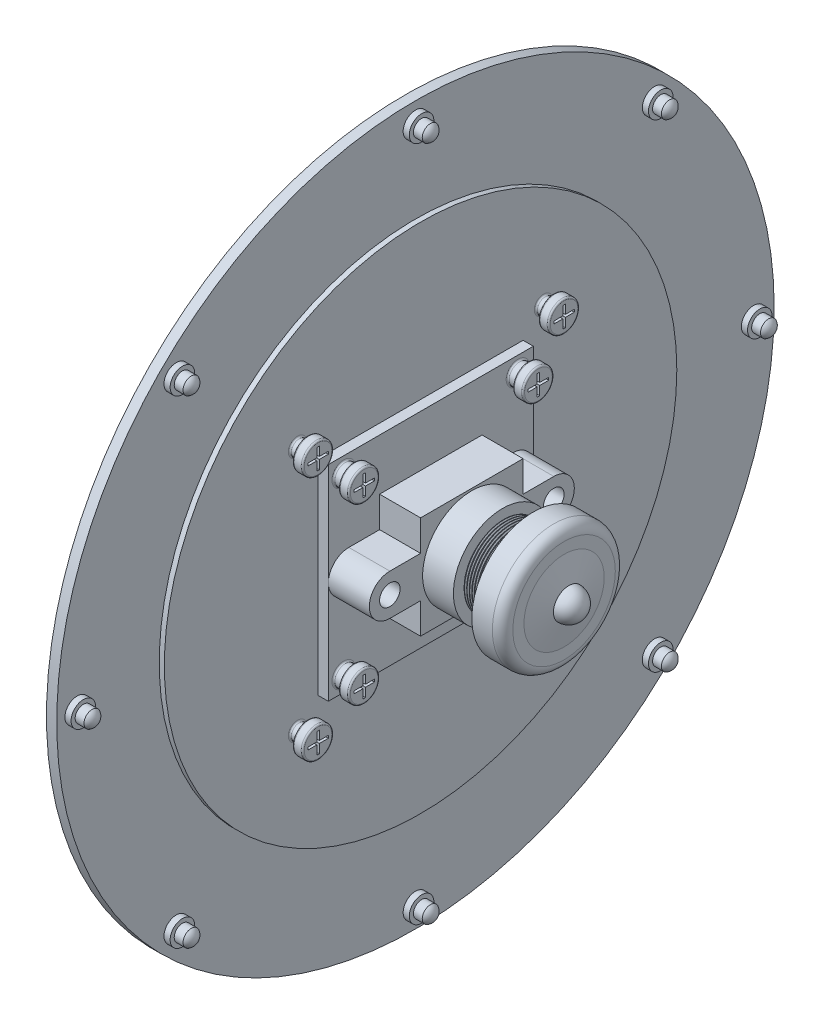
from build123d import *
from build123d.topology import SkipClean

# Parameters (mm, degrees)
SKETCH_1_R               = 35
EXTRUDE_1_DEPTH          = 1
SKETCH_2_W               = 30
SKETCH_2_H               = 30
EXTRUDE_2_DEPTH          = 0.5
EXTRUDE_3_DEPTH          = 5
SKETCH_4_R               = 1
CUT_EXTRUDE_1_DEPTH      = 20
SKETCH_5_R               = 4.8
EXTRUDE_4_DEPTH          = 3
SKETCH_6_R               = 3.75
EXTRUDE_5_DEPTH          = 2
THREAD_1_PITCH           = 0.25
SKETCH_10_R              = 4.088394557
EXTRUDE_6_DEPTH          = 1
SKETCH_11_R              = 6
EXTRUDE_7_DEPTH          = 3
FILLET_1_R               = 1
SKETCH_15_R              = 1.5
EXTRUDE_8_DEPTH          = 2
PATTERN_CIRCULAR_1_COUNT = 8
EXTRUDE_START            = -1
EXTRUDE_9_OUTLINE_R      = 25
EXTRUDE_9_OUTLINE_W      = 30
EXTRUDE_9_OUTLINE_H      = 30
EXTRUDE_9_DEPTH          = 1
SKETCH_18_W              = 20
SKETCH_18_H              = 20
EXTRUDE_10_DEPTH         = 1
EXTRUDE_11_DEPTH         = 2.5
EXTRUDE_12_DEPTH         = 0.5
SKETCH_22_R              = 1
EXTRUDE_13_DEPTH         = 2
SKETCH_23_R              = 1.5
EXTRUDE_14_DEPTH         = 1
SKETCH_24_W              = 2
SKETCH_24_H              = 0.25
CUT_EXTRUDE_2_DEPTH      = 0.5
SKETCH_25_W              = 0.25
SKETCH_25_H              = 2
CUT_EXTRUDE_3_DEPTH      = 0.5
FILLET_2_R               = 0.15
FILLET_3_R               = 0.15
FILLET_4_R               = 0.15
FILLET_5_R               = 0.15
FILLET_6_R               = 0.15
FILLET_7_R               = 0.15
FILLET_8_R               = 0.15
FILLET_9_R               = 0.15
SKETCH_26_W              = 1
SKETCH_26_H              = 0.75
PATTERN_CIRCULAR_2_COUNT = 4
SKETCH_27_W              = 2
SKETCH_27_H              = 0.25
CUT_EXTRUDE_4_DEPTH      = 0.5
SKETCH_28_W              = 0.25
SKETCH_28_H              = 2
CUT_EXTRUDE_5_DEPTH      = 0.5
FILLET_10_R              = 0.15
FILLET_11_R              = 0.15
PATTERN_CIRCULAR_5_COUNT = 4
FILLET_12_R              = 0.15
FILLET_13_R              = 0.15
FILLET_14_R              = 0.15
FILLET_15_R              = 0.15
FILLET_16_R              = 0.15
FILLET_17_R              = 0.15


with BuildPart() as part:
    # Sketch 1 → 凸台-拉伸1 (new body)
    with BuildSketch(Plane(origin=(0, 0, 0), x_dir=(0, 0, -1), z_dir=(1, 0, 0))):
        Circle(SKETCH_1_R)
    extrude(amount=EXTRUDE_1_DEPTH)

    # 草图2 → 凸台-拉伸2 (add)
    with BuildSketch(Plane(origin=(1, 0, 0), x_dir=(0, 0, -1), z_dir=(1, 0, 0))):
        Rectangle(SKETCH_2_W, SKETCH_2_H)
    extrude(amount=EXTRUDE_2_DEPTH)

    # 草图3 → 凸台-拉伸3 (add)
    with BuildSketch(Plane(origin=(1.5, 0, 0), x_dir=(0, 0, -1), z_dir=(1, 0, 0))):
        with BuildLine():
            Line((-5, 5), (5, 5))
            Line((5, 5), (5, 2))
            Line((5, 2), (8, 2))
            ThreePointArc((8, 2), (10, 0), (8, -2))
            Line((8, -2), (5, -2))
            Line((5, -2), (5, -5))
            Line((5, -5), (-5, -5))
            Line((-5, -5), (-5, -2))
            Line((-5, -2), (-8, -2))
            ThreePointArc((-8, -2), (-10, 0), (-8, 2))
            Line((-8, 2), (-5, 2))
            Line((-5, 2), (-5, 5))
        make_face()
    extrude(amount=EXTRUDE_3_DEPTH)

    # 草图4 → 切除-拉伸1 (cut)
    with BuildSketch(Plane(origin=(6.5, 0, 0), x_dir=(0, 0, -1), z_dir=(1, 0, 0))):
        with Locations((-8, 0)):
            Circle(SKETCH_4_R)
        with Locations((8, 0)):
            Circle(SKETCH_4_R)
    extrude(amount=-CUT_EXTRUDE_1_DEPTH, mode=Mode.SUBTRACT)

    # 草图5 → 凸台-拉伸4 (add)
    with BuildSketch(Plane(origin=(6.5, 0, 0), x_dir=(0, 0, -1), z_dir=(1, 0, 0))):
        Circle(SKETCH_5_R)
    extrude(amount=EXTRUDE_4_DEPTH)

    # 草图6 → 凸台-拉伸5 (add)
    with BuildSketch(Plane(origin=(9.5, 0, 0), x_dir=(0, 0, -1), z_dir=(1, 0, 0))):
        Circle(SKETCH_6_R)
    extrude(amount=EXTRUDE_5_DEPTH)

    # 螺纹线1: arcs per turn and ends read off the stored shape
    # 螺纹线1: the profile of Sketch 1 2 profile screwed along a right-hand helix through 8 turns, 6 arcs to a turn; built about Z, then put on its axis
    with SkipClean():  # the faces are left unmerged after this step: merging them gives an invalid solid
        thread_1_z = Axis((0, 0, 0), (0, 0, 1))
        thread_1_corners = [(3.7497, 0, -0.000173205), (3.885316469, 0, 0.078125), (3.885316469, 0, 0.109375), (3.7497, 0, 0.187673204)]
        with BuildLine(mode=Mode.PRIVATE) as thread_1_profile:
            Line(thread_1_corners[0], thread_1_corners[1])
            Line(thread_1_corners[1], thread_1_corners[2])
            Line(thread_1_corners[2], thread_1_corners[3])
            Line(thread_1_corners[3], thread_1_corners[0])
        thread_1_cap = Face(thread_1_profile.wire())
        thread_1_turn_angles = [0, 30, 60, 90, 120, 150, 180, 210, 240, 270, 300, 330, 360]
        thread_1_turn_weights = [1, 0.8660254037844387, 1, 0.8660254037844387, 1, 0.8660254037844387, 1, 0.8660254037844387, 1, 0.8660254037844387, 1, 0.8660254037844387, 1]
        thread_1_turn_rails = [Edge.make_bspline([Vector(p[0], p[1], 0).rotate(thread_1_z, thread_1_turn_angles[k]) / thread_1_turn_weights[k] + Vector(0, 0, p[2] + THREAD_1_PITCH * thread_1_turn_angles[k] / 360) for k in range(13)], [0, 0, 0, 1, 1, 2, 2, 3, 3, 4, 4, 5, 5, 6, 6, 6], 2, thread_1_turn_weights) for p in thread_1_corners]
        thread_1_turn_sides = [Face.make_surface_from_curves(thread_1_turn_rails[p[0]], thread_1_turn_rails[p[1]]) for p in [(0, 1), (1, 2), (2, 3), (3, 0)]]
        thread_1 = Plane(origin=(11.5, 0, 0), x_dir=(0, 0, 1), z_dir=(-1, 0, 0)) * Solid(Shell([*[p.moved(Location((0, 0, THREAD_1_PITCH * i))) for i in range(8) for p in thread_1_turn_sides], thread_1_cap, thread_1_cap.rotate(thread_1_z, 2880).moved(Location((0, 0, THREAD_1_PITCH * 2880 / 360)))]))
        add(thread_1)

    # 草图10 → 凸台-拉伸6 (add)
    with BuildSketch(Plane(origin=(11.5, 0, 0), x_dir=(0, 0, -1), z_dir=(1, 0, 0))):
        Circle(SKETCH_10_R)
    extrude(amount=EXTRUDE_6_DEPTH)

    # 草图11 → 凸台-拉伸7 (add)
    with BuildSketch(Plane(origin=(12.5, 0, 0), x_dir=(0, 0, -1), z_dir=(1, 0, 0))):
        Circle(SKETCH_11_R)
    extrude(amount=EXTRUDE_7_DEPTH)

    # 草图12 → 切除-旋转1 (revolve, cut)
    with BuildSketch(Plane(origin=(0, 0, 0), x_dir=(1, 0, 0), z_dir=(0, 1, 0))):
        with BuildLine():
            Line((13, 0), (18, 0))
            ThreePointArc((18, 0), (15.5, 2.5), (13, 0))
        make_face()
    revolve(axis=Axis((13, 0, 0), (1, 0, 0)), mode=Mode.SUBTRACT)

    # 草图13 → 旋转1 (revolve)
    with BuildSketch(Plane(origin=(0, 0, 0), x_dir=(1, 0, 0), z_dir=(0, 1, 0))):
        with BuildLine():
            Line((14.629101665, 0.694423602), (12.71073563, 0.694423602))
            Line((12.71073563, 0.694423602), (12.71073563, 0))
            Line((12.71073563, 0), (17.458678989, 0))
            ThreePointArc((17.458678989, 0), (16.316194033, 1.456771428), (14.629101665, 0.694423602))
        make_face()
    revolve(axis=Axis((12.71073563, 0, 0), (1, 0, 0)))

    # 草图14 → 旋转2 (revolve)
    with BuildSketch(Plane(origin=(0, 0, 0), x_dir=(1, 0, 0), z_dir=(0, 1, 0))):
        Polygon((15.5, 3.915793953), (15.958678989, 1.5), (15.958678989, 0), (13.41942427, 0), (13.41942427, 3.915793953), align=None)
    revolve(axis=Axis((15.958678989, 0, 0), (-1, 0, 0)))

    # 圆角1
    fillet_1_edges = [part.edges().sort_by_distance(p)[0] for p in [
        (15.5, 0, 6),
    ]]
    fillet(fillet_1_edges, radius=FILLET_1_R)

    # 草图15 → 凸台-拉伸8 (add)
    with BuildSketch(Plane(origin=(1.5, 0, 0), x_dir=(0, 0, -1), z_dir=(1, 0, 0))):
        with Locations((-12, 12)):
            Circle(SKETCH_15_R)
        with Locations((12, 12)):
            Circle(SKETCH_15_R)
        with Locations((-12, -12)):
            Circle(SKETCH_15_R)
        with Locations((12, -12)):
            Circle(SKETCH_15_R)
    extrude(amount=EXTRUDE_8_DEPTH)

    # 草图16 → 旋转3 (revolve)
    with BuildSketch(Plane.XY, mode=Mode.PRIVATE) as revolve_3_sk:
        with BuildLine():
            Line((1, 33), (2, 33))
            Line((2, 33), (2.923760431, 33))
            ThreePointArc((2.923760431, 33), (2.8, 33.461880215), (2.461880215, 33.8))
            Line((2.461880215, 33.8), (1.6, 33.8))
            Line((1.6, 33.8), (1.6, 34.2))
            Line((1.6, 34.2), (1, 34.2))
            Line((1, 34.2), (1, 33))
        make_face()
    revolve_3 = revolve(revolve_3_sk.sketch.rotate(Axis((1, 33, 0), (1, 0, 0)), 90), axis=Axis((1, 33, 0), (1, 0, 0)))

    # 阵列(圆周)1: 旋转3 ×8 about axis
    pattern_circular_1_axis = Axis((0, 0, 0), (1, 0, 0))
    for i in range(1, PATTERN_CIRCULAR_1_COUNT):
        add(revolve_3.rotate(pattern_circular_1_axis, i * 360 / PATTERN_CIRCULAR_1_COUNT))

    # 凸台-拉伸9: read off the stored shape, not the designer's step
    # 凸台-拉伸9 outline → 凸台-拉伸9 (add)
    with BuildSketch(Plane(origin=(1.5, 0, 0), x_dir=(0, 0, -1), z_dir=(1, 0, 0)).offset(EXTRUDE_START)):
        Circle(EXTRUDE_9_OUTLINE_R)
        Rectangle(EXTRUDE_9_OUTLINE_W, EXTRUDE_9_OUTLINE_H, mode=Mode.SUBTRACT)
    extrude(amount=EXTRUDE_9_DEPTH)

    # 草图18 → 凸台-拉伸10 (add)
    with BuildSketch(Plane(origin=(1.5, 0, 0), x_dir=(0, 0, -1), z_dir=(1, 0, 0))):
        Rectangle(SKETCH_18_W, SKETCH_18_H)
    extrude(amount=EXTRUDE_10_DEPTH)

    # 草图20 → 凸台-拉伸11 (add)
    with BuildSketch(Plane(origin=(2.5, 0, 0), x_dir=(0, 0, -1), z_dir=(1, 0, 0))):
        with BuildLine():
            Line((1.2, -5.6), (4.2, -5.6))
            ThreePointArc((4.2, -5.6), (4.6, -6), (4.2, -6.4))
            Line((4.2, -6.4), (1.2, -6.4))
            ThreePointArc((1.2, -6.4), (0.8, -6), (1.2, -5.6))
        make_face()
    extrude(amount=EXTRUDE_11_DEPTH)

    # 草图21 → 凸台-拉伸12 (add)
    with BuildSketch(Plane(origin=(2.5, 0, 0), x_dir=(0, 0, -1), z_dir=(1, 0, 0))):
        with BuildLine():
            Line((1.2, -5.395527271), (4.2, -5.395527271))
            ThreePointArc((4.2, -5.395527271), (4.804472729, -6), (4.2, -6.604472729))
            Line((4.2, -6.604472729), (1.2, -6.604472729))
            ThreePointArc((1.2, -6.604472729), (0.595527271, -6), (1.2, -5.395527271))
        make_face()
    extrude(amount=EXTRUDE_12_DEPTH)

    # 草图22 → 凸台-拉伸13 (add)
    with BuildSketch(Plane(origin=(2.5, 0, 0), x_dir=(0, 0, -1), z_dir=(1, 0, 0))):
        with Locations((-8.5, -8.5)):
            Circle(SKETCH_22_R)
        with Locations((8.5, -8.5)):
            Circle(SKETCH_22_R)
        with Locations((-8.5, 8.5)):
            Circle(SKETCH_22_R)
        with Locations((8.5, 8.5)):
            Circle(SKETCH_22_R)
    extrude(amount=EXTRUDE_13_DEPTH)

    # 草图23 → 凸台-拉伸14 (add)
    with BuildSketch(Plane(origin=(4.5, 0, 0), x_dir=(0, 0, -1), z_dir=(1, 0, 0))):
        with Locations((-8.5, 8.5)):
            Circle(SKETCH_23_R)
        with Locations((8.5, 8.5)):
            Circle(SKETCH_23_R)
        with Locations((-8.5, -8.5)):
            Circle(SKETCH_23_R)
        with Locations((8.5, -8.5)):
            Circle(SKETCH_23_R)
    extrude(amount=-EXTRUDE_14_DEPTH)

    # 草图24 → 切除-拉伸2 (cut)
    with BuildSketch(Plane(origin=(4.5, 0, 0), x_dir=(0, 0, -1), z_dir=(1, 0, 0))):
        with Locations((-8.5, 8.5)):
            Rectangle(SKETCH_24_W, SKETCH_24_H)
        with Locations((8.5, 8.5)):
            Rectangle(SKETCH_24_W, SKETCH_24_H)
        with Locations((-8.5, -8.5)):
            Rectangle(SKETCH_24_W, SKETCH_24_H)
        with Locations((8.5, -8.5)):
            Rectangle(SKETCH_24_W, SKETCH_24_H)
    extrude(amount=-CUT_EXTRUDE_2_DEPTH, mode=Mode.SUBTRACT)

    # 草图25 → 切除-拉伸3 (cut)
    with BuildSketch(Plane(origin=(4.5, 0, 0), x_dir=(0, 0, -1), z_dir=(1, 0, 0))):
        with Locations((-8.5, 8.5)):
            Rectangle(SKETCH_25_W, SKETCH_25_H)
        with Locations((8.5, 8.5)):
            Rectangle(SKETCH_25_W, SKETCH_25_H)
        with Locations((-8.5, -8.5)):
            Rectangle(SKETCH_25_W, SKETCH_25_H)
        with Locations((8.5, -8.5)):
            Rectangle(SKETCH_25_W, SKETCH_25_H)
    extrude(amount=-CUT_EXTRUDE_3_DEPTH, mode=Mode.SUBTRACT)

    # 圆角2
    fillet_2_edges = [part.edges().sort_by_distance(p)[0] for p in [
        (3.5, -8.5, 10),
        (4.5, -8.5, 10),
    ]]
    fillet(fillet_2_edges, radius=FILLET_2_R)

    # 圆角3
    fillet_3_edges = [part.edges().sort_by_distance(p)[0] for p in [
        (3.5, 8.5, 10),
        (4.5, 8.5, 10),
    ]]
    fillet(fillet_3_edges, radius=FILLET_3_R)

    # 圆角4
    fillet_4_edges = [part.edges().sort_by_distance(p)[0] for p in [
        (3.5, -8.5, -7),
        (4.5, -8.5, -7),
    ]]
    fillet(fillet_4_edges, radius=FILLET_4_R)

    # 圆角5
    fillet_5_edges = [part.edges().sort_by_distance(p)[0] for p in [
        (3.5, 8.5, -7),
        (4.5, 8.5, -7),
    ]]
    fillet(fillet_5_edges, radius=FILLET_5_R)

    # 圆角6
    fillet_6_edges = [part.edges().sort_by_distance(p)[0] for p in [
        (2.5, 8.5, -7.5),
        (3.5, 8.5, -7.5),
    ]]
    fillet(fillet_6_edges, radius=FILLET_6_R)

    # 圆角7
    fillet_7_edges = [part.edges().sort_by_distance(p)[0] for p in [
        (2.5, 8.5, 9.5),
        (3.5, 8.5, 9.5),
    ]]
    fillet(fillet_7_edges, radius=FILLET_7_R)

    # 圆角8
    fillet_8_edges = [part.edges().sort_by_distance(p)[0] for p in [
        (2.5, -8.5, 9.5),
        (3.5, -8.5, 9.5),
    ]]
    fillet(fillet_8_edges, radius=FILLET_8_R)

    # 圆角9
    fillet_9_edges = [part.edges().sort_by_distance(p)[0] for p in [
        (2.5, -8.5, -7.5),
        (3.5, -8.5, -7.5),
    ]]
    fillet(fillet_9_edges, radius=FILLET_9_R)

    # 草图26 → 切除-旋转2 (revolve, cut)
    with BuildSketch(Plane(origin=(0, 0, 0), x_dir=(-1, 0, 0), z_dir=(0, 0.7071067811865475, -0.7071067811865477)), mode=Mode.PRIVATE) as cut_revolve_2_sk:
        with Locations((-2, 18.095562748)):
            Rectangle(SKETCH_26_W, SKETCH_26_H)
    cut_revolve_2 = revolve(cut_revolve_2_sk.sketch.rotate(Axis((8.497822495, 12, 12), (-1, 0, 0)), 135), axis=Axis((8.497822495, 12, 12), (-1, 0, 0)), mode=Mode.SUBTRACT)

    # 阵列(圆周)2: 切除-旋转2 ×4 about axis
    pattern_circular_2_axis = Axis((0, 0, 0), (1, 0, 0))
    for i in range(1, PATTERN_CIRCULAR_2_COUNT):
        add(cut_revolve_2.rotate(pattern_circular_2_axis, i * 360 / PATTERN_CIRCULAR_2_COUNT), mode=Mode.SUBTRACT)

    # 草图27 → 切除-拉伸4 (cut)
    with BuildSketch(Plane(origin=(3.5, 0, 0), x_dir=(0, 0, -1), z_dir=(1, 0, 0))):
        with Locations((-12, 12)):
            Rectangle(SKETCH_27_W, SKETCH_27_H)
    cut_extrude_4 = extrude(amount=-CUT_EXTRUDE_4_DEPTH, mode=Mode.SUBTRACT)

    # 草图28 → 切除-拉伸5 (cut)
    with BuildSketch(Plane(origin=(3.5, 0, 0), x_dir=(0, 0, -1), z_dir=(1, 0, 0))):
        with Locations((-12, 12)):
            Rectangle(SKETCH_28_W, SKETCH_28_H)
    cut_extrude_5 = extrude(amount=-CUT_EXTRUDE_5_DEPTH, mode=Mode.SUBTRACT)

    # 圆角10
    fillet_10_edges = [part.edges().sort_by_distance(p)[0] for p in [
        (3.5, 12, 13.5),
        (2.5, 12, 13.5),
    ]]
    fillet(fillet_10_edges, radius=FILLET_10_R)

    # 圆角11
    fillet_11_edges = [part.edges().sort_by_distance(p)[0] for p in [
        (2.5, 12, 12.75),
        (1.5, 12, 12.75),
    ]]
    fillet(fillet_11_edges, radius=FILLET_11_R)

    # 阵列(圆周)5: 切除-拉伸4, 切除-拉伸5 ×4 about axis
    pattern_circular_5_axis = Axis((0, 0, 0), (1, 0, 0))
    add([cut_extrude_4.rotate(pattern_circular_5_axis, i * 360 / PATTERN_CIRCULAR_5_COUNT) for i in range(1, PATTERN_CIRCULAR_5_COUNT)], mode=Mode.SUBTRACT)
    add([cut_extrude_5.rotate(pattern_circular_5_axis, i * 360 / PATTERN_CIRCULAR_5_COUNT) for i in range(1, PATTERN_CIRCULAR_5_COUNT)], mode=Mode.SUBTRACT)

    # 圆角12
    fillet_12_edges = [part.edges().sort_by_distance(p)[0] for p in [
        (3.5, -12, 13.5),
        (2.5, -12, 13.5),
    ]]
    fillet(fillet_12_edges, radius=FILLET_12_R)

    # 圆角13
    fillet_13_edges = [part.edges().sort_by_distance(p)[0] for p in [
        (2.5, -12.75, 12),
        (1.5, -12.75, 12),
    ]]
    fillet(fillet_13_edges, radius=FILLET_13_R)

    # 圆角14
    fillet_14_edges = [part.edges().sort_by_distance(p)[0] for p in [
        (3.5, -12, -10.5),
        (2.5, -12, -10.5),
    ]]
    fillet(fillet_14_edges, radius=FILLET_14_R)

    # 圆角15
    fillet_15_edges = [part.edges().sort_by_distance(p)[0] for p in [
        (2.5, -12, -12.75),
        (1.5, -12, -12.75),
    ]]
    fillet(fillet_15_edges, radius=FILLET_15_R)

    # 圆角16
    fillet_16_edges = [part.edges().sort_by_distance(p)[0] for p in [
        (3.5, 12, -10.5),
        (2.5, 12, -10.5),
    ]]
    fillet(fillet_16_edges, radius=FILLET_16_R)

    # 圆角17
    fillet_17_edges = [part.edges().sort_by_distance(p)[0] for p in [
        (2.5, 12.75, -12),
        (1.5, 12.75, -12),
    ]]
    fillet(fillet_17_edges, radius=FILLET_17_R)


solid = part.part
